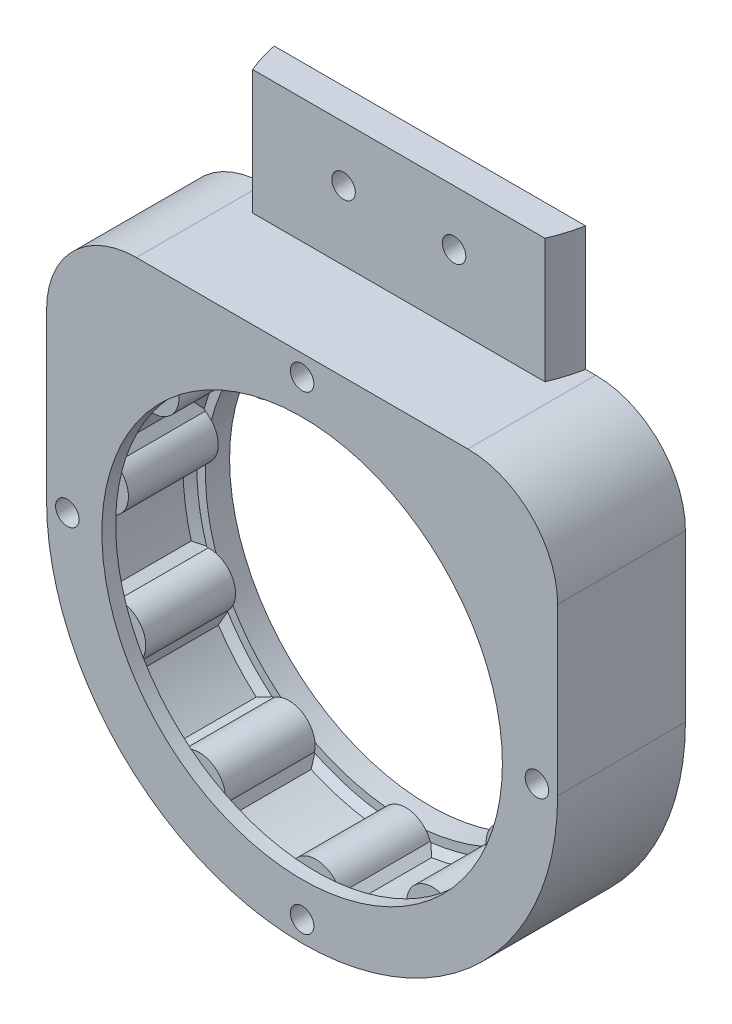
from build123d import *

# Parameters (mm, degrees)
SKETCH_1_R          = 1.7
EXTRUDE_1_DEPTH     = 13
SKETCH_2_R          = 29
EXTRUDE_2_DEPTH     = 2
EXTRUDE_START       = 3.5
SKETCH_3_R          = 29
EXTRUDE_3_DEPTH     = 3.5
CHAMFER_1_SIZE      = 1
EXTRUDE_4_DEPTH     = 18
SKETCH_5_R          = 1.7
CUT_EXTRUDE_1_DEPTH = 18
CUT_EXTRUDE_START   = -18.5
SKETCH_6_R          = 1.7
CUT_EXTRUDE_2_DEPTH = 18.5


with BuildPart() as part:
    # 草图1 → 凸台-拉伸1 (new body)
    with BuildSketch(Plane.XY):
        with BuildLine():
            Line((-37, 0), (-37, 24))
            ThreePointArc((-37, 24), (-33.192388155, 33.192388155), (-24, 37))
            Line((-24, 37), (24, 37))
            ThreePointArc((24, 37), (33.192388155, 33.192388155), (37, 24))
            Line((37, 24), (37, 0))
            ThreePointArc((37, 0), (0, -37), (-37, 0))
        make_face()
        with Locations(Location((0, -34, 0), (0, 0, 180))):
            Circle(SKETCH_1_R, mode=Mode.SUBTRACT)
        with Locations(Location((-34, 0, 0), (0, 0, 180))):
            Circle(SKETCH_1_R, mode=Mode.SUBTRACT)
        with Locations(Location((0, 34, 0), (0, 0, 180))):
            Circle(SKETCH_1_R, mode=Mode.SUBTRACT)
        with Locations(Location((34, 0, 0), (0, 0, 180))):
            Circle(SKETCH_1_R, mode=Mode.SUBTRACT)
        with BuildLine():
            ThreePointArc((-31.233783039, 0.679693363), (-30.923187588, -4.446083156), (-29.777103616, -9.451734562))
            ThreePointArc((-29.777103616, -9.451734562), (-24.98031659, -11.408128335), (-26.643000301, -16.314463551))
            ThreePointArc((-26.643000301, -16.314463551), (-23.610506772, -20.458620578), (-19.940100115, -24.050022732))
            ThreePointArc((-19.940100115, -24.050022732), (-14.847079754, -23.102507047), (-13.593253218, -28.128893561))
            ThreePointArc((-13.593253218, -28.128893561), (-8.801656881, -29.97569052), (-3.772255717, -31.012598614))
            ThreePointArc((-3.772255717, -31.012598614), (0, -27.462003005), (3.772255717, -31.012598614))
            ThreePointArc((3.772255717, -31.012598614), (8.801656881, -29.97569052), (13.593253218, -28.128893561))
            ThreePointArc((13.593253218, -28.128893561), (14.847079754, -23.102507047), (19.940100115, -24.050022732))
            ThreePointArc((19.940100115, -24.050022732), (23.610506772, -20.458620578), (26.643000301, -16.314463551))
            ThreePointArc((26.643000301, -16.314463551), (24.98031659, -11.408128335), (29.777103616, -9.451734562))
            ThreePointArc((29.777103616, -9.451734562), (30.923187588, -4.446083156), (31.233783039, 0.679693363))
            ThreePointArc((31.233783039, 0.679693363), (27.182479412, 3.908250516), (30.160087115, 8.147412549))
            ThreePointArc((30.160087115, 8.147412549), (28.417974836, 12.978054253), (25.90806035, 17.458052438))
            ThreePointArc((25.90806035, 17.458052438), (20.754397082, 17.983787444), (20.967456055, 23.159813742))
            ThreePointArc((20.967456055, 23.159813742), (16.890255867, 26.281751136), (12.356711557, 28.693603216))
            ThreePointArc((12.356711557, 28.693603216), (7.736940323, 26.349598925), (5.117805847, 30.819137712))
            ThreePointArc((5.117805847, 30.819137712), (0, 31.241177731), (-5.117805847, 30.819137712))
            ThreePointArc((-5.117805847, 30.819137712), (-7.736940323, 26.349598925), (-12.356711557, 28.693603216))
            ThreePointArc((-12.356711557, 28.693603216), (-16.890255867, 26.281751136), (-20.967456055, 23.159813742))
            ThreePointArc((-20.967456055, 23.159813742), (-20.754397082, 17.983787444), (-25.90806035, 17.458052438))
            ThreePointArc((-25.90806035, 17.458052438), (-28.417974836, 12.978054253), (-30.160087115, 8.147412549))
            ThreePointArc((-30.160087115, 8.147412549), (-27.182479412, 3.908250516), (-31.233783039, 0.679693363))
        make_face(mode=Mode.SUBTRACT)
    extrude(amount=EXTRUDE_1_DEPTH)

    # 草图2 → 凸台-拉伸2 (add)
    with BuildSketch(Plane.XY.offset(13)):
        with BuildLine():
            Line((-37, 0), (-37, 24))
            ThreePointArc((-37, 24), (-33.192388155, 33.192388155), (-24, 37))
            Line((-24, 37), (24, 37))
            ThreePointArc((24, 37), (33.192388155, 33.192388155), (37, 24))
            Line((37, 24), (37, 0))
            ThreePointArc((37, 0), (0, -37), (-37, 0))
        make_face()
        with Locations(Location((0, 0, 0), (0, 0, 177.612919058))):
            Circle(SKETCH_2_R, mode=Mode.SUBTRACT)
    extrude(amount=EXTRUDE_2_DEPTH)

    # 草图3 → 凸台-拉伸3 (add)
    with BuildSketch(Plane(origin=(0, 0, 0), x_dir=(-1, 0, 0), z_dir=(0, 0, -1)).offset(EXTRUDE_START)):
        with BuildLine():
            Line((-37, 0), (-37, 24))
            ThreePointArc((-37, 24), (-33.192388155, 33.192388155), (-24, 37))
            Line((-24, 37), (24, 37))
            ThreePointArc((24, 37), (33.192388155, 33.192388155), (37, 24))
            Line((37, 24), (37, 0))
            ThreePointArc((37, 0), (0, -37), (-37, 0))
        make_face()
        with Locations(Location((0, 0, 0), (0, 0, 2.387080942))):
            Circle(SKETCH_3_R, mode=Mode.SUBTRACT)
    extrude(amount=-EXTRUDE_3_DEPTH)

    # 倒角1
    # the kernel refuses this chamfer: 1, 0.944596536 mm, written as the material it adds along each edge
    with BuildSketch(Plane(origin=(0, 0, 0), x_dir=(-0.31866658994090813, 0.9478668706392439, 0), z_dir=(0.9478668706392439, 0.31866658994090813, 0))) as chamfer_1_piece_1:
        Polygon((31.241177731, CHAMFER_1_SIZE), (31.241177731 - CHAMFER_1_SIZE, 0), (31.241177731, 0), align=None)
    revolve(axis=Axis((0, 0, 0), (0, 0, 1)), revolution_arc=28.28993535)
    with BuildSketch(Plane(origin=(-12.356711557, 28.693603216, -2.820532611), x_dir=(-0.9121077850632814, -0.4099504706997601, 0), z_dir=(0, 0, 1))) as chamfer_1_piece_2_section:
        with BuildLine():
            Line((0.984606671, 0), (-0.076111739, 1.094687855))
            ThreePointArc((-0.076111739, 1.094687855), (0.000780153, 0.565592653), (0, 0))
            ThreePointArc((0, 0), (0.506216191, -0.003876039), (0.984606671, 0))
        make_face()
    chamfer_1_piece_2 = extrude(amount=18.641065222, mode=Mode.PRIVATE)
    chamfer_1_piece_2 = split(chamfer_1_piece_2, bisect_by=Plane(origin=(-12.356711557, 28.693603216, 15), z_dir=(0, 0, -1)), keep=Keep.TOP, mode=Mode.PRIVATE)
    add(chamfer_1_piece_2)
    with BuildSketch(Plane(origin=(-20.967456055, 23.159813742, -3.103978486), x_dir=(0.5936937329851186, -0.8046910906765371, 0), z_dir=(0, 0, 1))) as chamfer_1_piece_3_section:
        with BuildLine():
            Line((1.208926853, 0), (-0.079335217, 0.928995572))
            ThreePointArc((-0.079335217, 0.928995572), (-0.044239575, 0.477185886), (0, 0))
            ThreePointArc((0, 0), (0.620948577, 0.048617953), (1.208926853, 0))
        make_face()
    chamfer_1_piece_3 = extrude(amount=19.207956973, mode=Mode.PRIVATE)
    chamfer_1_piece_3 = split(chamfer_1_piece_3, bisect_by=Plane(origin=(-20.967456055, 23.159813742, 15), z_dir=(0, 0, -1)), keep=Keep.TOP, mode=Mode.PRIVATE)
    add(chamfer_1_piece_3)
    with BuildSketch(Plane(origin=(0, 0, 0), x_dir=(-0.7805349143645341, 0.6251121878974599, 0), z_dir=(0.6251121878974599, 0.7805349143645341, 0))) as chamfer_1_piece_4:
        Polygon((31.241177731, CHAMFER_1_SIZE), (31.241177731 - CHAMFER_1_SIZE, 0), (31.241177731, 0), align=None)
    revolve(axis=Axis((0, 0, 0), (0, 0, 1)), revolution_arc=28.28993535)
    with BuildSketch(Plane(origin=(-25.90806035, 17.458052438, -2.820532611), x_dir=(0.8738254486368232, -0.48623974057521735, 0), z_dir=(0, 0, 1))) as chamfer_1_piece_5_section:
        with BuildLine():
            Line((1.097330623, 0), (-0.068293114, -0.982235383))
            ThreePointArc((-0.068293114, -0.982235383), (-0.038978268, -0.504728194), (0, 0))
            ThreePointArc((0, 0), (0.56417639, -0.040008237), (1.097330623, 0))
        make_face()
    chamfer_1_piece_5 = extrude(amount=18.641065222, mode=Mode.PRIVATE)
    chamfer_1_piece_5 = split(chamfer_1_piece_5, bisect_by=Plane(origin=(-25.90806035, 17.458052438, 15), z_dir=(0, 0, -1)), keep=Keep.TOP, mode=Mode.PRIVATE)
    add(chamfer_1_piece_5)
    with BuildSketch(Plane(origin=(-30.160087115, 8.147412549, -3.103978486), x_dir=(0.9344957993560614, -0.3559741577500759, 0), z_dir=(0, 0, 1))) as chamfer_1_piece_6_section:
        with BuildLine():
            Line((1.208926853, 0), (-0.079335217, 0.928995572))
            ThreePointArc((-0.079335217, 0.928995572), (-0.044239575, 0.477185886), (0, 0))
            ThreePointArc((0, 0), (0.620948577, 0.048617953), (1.208926853, 0))
        make_face()
    chamfer_1_piece_6 = extrude(amount=19.207956973, mode=Mode.PRIVATE)
    chamfer_1_piece_6 = split(chamfer_1_piece_6, bisect_by=Plane(origin=(-30.160087115, 8.147412549, 15), z_dir=(0, 0, -1)), keep=Keep.TOP, mode=Mode.PRIVATE)
    add(chamfer_1_piece_6)
    with BuildSketch(Plane(origin=(0, 0, 0), x_dir=(-0.9945889184735878, 0.10388880232988909, 0), z_dir=(0.10388880232988909, 0.9945889184735878, 0))) as chamfer_1_piece_7:
        Polygon((31.241177731, CHAMFER_1_SIZE), (31.241177731 - CHAMFER_1_SIZE, 0), (31.241177731, 0), align=None)
    revolve(axis=Axis((0, 0, 0), (0, 0, 1)), revolution_arc=28.28993535)
    with BuildSketch(Plane(origin=(-31.233783039, 0.679693363, -2.820532611), x_dir=(0.9979897965675029, 0.06337480530269161, 0), z_dir=(0, 0, 1))) as chamfer_1_piece_8_section:
        with BuildLine():
            Line((1.097330623, 0), (-0.068293114, -0.982235383))
            ThreePointArc((-0.068293114, -0.982235383), (-0.038978268, -0.504728194), (0, 0))
            ThreePointArc((0, 0), (0.56417639, -0.040008237), (1.097330623, 0))
        make_face()
    chamfer_1_piece_8 = extrude(amount=18.641065222, mode=Mode.PRIVATE)
    chamfer_1_piece_8 = split(chamfer_1_piece_8, bisect_by=Plane(origin=(-31.233783039, 0.679693363, 15), z_dir=(0, 0, -1)), keep=Keep.TOP, mode=Mode.PRIVATE)
    add(chamfer_1_piece_8)
    with BuildSketch(Plane(origin=(-29.777103616, -9.451734562, -3.103978486), x_dir=(0.9786020522632545, 0.20576205506882564, 0), z_dir=(0, 0, 1))) as chamfer_1_piece_9_section:
        with BuildLine():
            Line((1.208926853, 0), (-0.079335217, 0.928995572))
            ThreePointArc((-0.079335217, 0.928995572), (-0.044239575, 0.477185886), (0, 0))
            ThreePointArc((0, 0), (0.620948577, 0.048617953), (1.208926853, 0))
        make_face()
    chamfer_1_piece_9 = extrude(amount=19.207956973, mode=Mode.PRIVATE)
    chamfer_1_piece_9 = split(chamfer_1_piece_9, bisect_by=Plane(origin=(-29.777103616, -9.451734562, 15), z_dir=(0, 0, -1)), keep=Keep.TOP, mode=Mode.PRIVATE)
    add(chamfer_1_piece_9)
    with BuildSketch(Plane(origin=(0, 0, 0), x_dir=(-0.892867968396763, -0.4503185439342214, 0), z_dir=(-0.4503185439342214, 0.892867968396763, 0))) as chamfer_1_piece_10:
        Polygon((31.241177731, CHAMFER_1_SIZE), (31.241177731 - CHAMFER_1_SIZE, 0), (31.241177731, 0), align=None)
    revolve(axis=Axis((0, 0, 0), (0, 0, 1)), revolution_arc=28.28993535)
    with BuildSketch(Plane(origin=(-26.643000301, -16.314463551, -2.820532611), x_dir=(0.5355842379268934, -0.8444818080244648, 0), z_dir=(0, 0, 1))) as chamfer_1_piece_11_section:
        with BuildLine():
            Line((0.984606671, 0), (-0.076111739, 1.094687855))
            ThreePointArc((-0.076111739, 1.094687855), (0.000780153, 0.565592653), (0, 0))
            ThreePointArc((0, 0), (0.506216191, -0.003876039), (0.984606671, 0))
        make_face()
    chamfer_1_piece_11 = extrude(amount=18.641065222, mode=Mode.PRIVATE)
    chamfer_1_piece_11 = split(chamfer_1_piece_11, bisect_by=Plane(origin=(-26.643000301, -16.314463551, 15), z_dir=(0, 0, -1)), keep=Keep.TOP, mode=Mode.PRIVATE)
    add(chamfer_1_piece_11)
    with BuildSketch(Plane(origin=(-19.940100115, -24.050022732, -3.103978486), x_dir=(0.7120090680485543, 0.7021702692485841, 0), z_dir=(0, 0, 1))) as chamfer_1_piece_12_section:
        with BuildLine():
            Line((1.208926853, 0), (-0.079335217, 0.928995572))
            ThreePointArc((-0.079335217, 0.928995572), (-0.044239575, 0.477185886), (0, 0))
            ThreePointArc((0, 0), (0.620948577, 0.048617953), (1.208926853, 0))
        make_face()
    chamfer_1_piece_12 = extrude(amount=19.207956973, mode=Mode.PRIVATE)
    chamfer_1_piece_12 = split(chamfer_1_piece_12, bisect_by=Plane(origin=(-19.940100115, -24.050022732, 15), z_dir=(0, 0, -1)), keep=Keep.TOP, mode=Mode.PRIVATE)
    add(chamfer_1_piece_12)
    with BuildSketch(Plane(origin=(0, 0, 0), x_dir=(-0.5076677470575643, -0.8615529342980017, 0), z_dir=(-0.8615529342980017, 0.5076677470575643, 0))) as chamfer_1_piece_13:
        Polygon((31.241177731, CHAMFER_1_SIZE), (31.241177731 - CHAMFER_1_SIZE, 0), (31.241177731, 0), align=None)
    revolve(axis=Axis((0, 0, 0), (0, 0, 1)), revolution_arc=28.28993535)
    with BuildSketch(Plane(origin=(-13.593253218, -28.128893561, -2.820532611), x_dir=(0.9071234673014191, -0.42086460420312277, 0), z_dir=(0, 0, 1))) as chamfer_1_piece_14_section:
        with BuildLine():
            Line((0.984606671, 0), (-0.076111739, 1.094687855))
            ThreePointArc((-0.076111739, 1.094687855), (0.000780153, 0.565592653), (0, 0))
            ThreePointArc((0, 0), (0.506216191, -0.003876039), (0.984606671, 0))
        make_face()
    chamfer_1_piece_14 = extrude(amount=18.641065222, mode=Mode.PRIVATE)
    chamfer_1_piece_14 = split(chamfer_1_piece_14, bisect_by=Plane(origin=(-13.593253218, -28.128893561, 15), z_dir=(0, 0, -1)), keep=Keep.TOP, mode=Mode.PRIVATE)
    add(chamfer_1_piece_14)
    with BuildSketch(Plane(origin=(-3.772255717, -31.012598614, -3.103978486), x_dir=(0.21935823554411138, 0.9756443842399618, 0), z_dir=(0, 0, 1))) as chamfer_1_piece_15_section:
        with BuildLine():
            Line((1.208926853, 0), (-0.079335217, 0.928995572))
            ThreePointArc((-0.079335217, 0.928995572), (-0.044239575, 0.477185886), (0, 0))
            ThreePointArc((0, 0), (0.620948577, 0.048617953), (1.208926853, 0))
        make_face()
    chamfer_1_piece_15 = extrude(amount=19.207956973, mode=Mode.PRIVATE)
    chamfer_1_piece_15 = split(chamfer_1_piece_15, bisect_by=Plane(origin=(-3.772255717, -31.012598614, 15), z_dir=(0, 0, -1)), keep=Keep.TOP, mode=Mode.PRIVATE)
    add(chamfer_1_piece_15)
    with BuildSketch(Plane(origin=(0, 0, 0), x_dir=(0.03871339696351753, -0.9992503554643075, 0), z_dir=(-0.9992503554643075, -0.03871339696351753, 0))) as chamfer_1_piece_16:
        Polygon((31.241177731, CHAMFER_1_SIZE), (31.241177731 - CHAMFER_1_SIZE, 0), (31.241177731, 0), align=None)
    revolve(axis=Axis((0, 0, 0), (0, 0, 1)), revolution_arc=28.28993535)
    with BuildSketch(Plane(origin=(3.772255717, -31.012598614, -2.820532611), x_dir=(0.9906574052358913, 0.13637413776552687, 0), z_dir=(0, 0, 1))) as chamfer_1_piece_17_section:
        with BuildLine():
            Line((0.984606671, 0), (-0.076111739, 1.094687855))
            ThreePointArc((-0.076111739, 1.094687855), (0.000780153, 0.565592653), (0, 0))
            ThreePointArc((0, 0), (0.506216191, -0.003876039), (0.984606671, 0))
        make_face()
    chamfer_1_piece_17 = extrude(amount=18.641065222, mode=Mode.PRIVATE)
    chamfer_1_piece_17 = split(chamfer_1_piece_17, bisect_by=Plane(origin=(3.772255717, -31.012598614, 15), z_dir=(0, 0, -1)), keep=Keep.TOP, mode=Mode.PRIVATE)
    add(chamfer_1_piece_17)
    with BuildSketch(Plane(origin=(13.593253218, -28.128893561, -3.103978486), x_dir=(-0.3429372868343612, 0.939358300808955, 0), z_dir=(0, 0, 1))) as chamfer_1_piece_18_section:
        with BuildLine():
            Line((1.208926853, 0), (-0.079335217, 0.928995572))
            ThreePointArc((-0.079335217, 0.928995572), (-0.044239575, 0.477185886), (0, 0))
            ThreePointArc((0, 0), (0.620948577, 0.048617953), (1.208926853, 0))
        make_face()
    chamfer_1_piece_18 = extrude(amount=19.207956973, mode=Mode.PRIVATE)
    chamfer_1_piece_18 = split(chamfer_1_piece_18, bisect_by=Plane(origin=(13.593253218, -28.128893561, 15), z_dir=(0, 0, -1)), keep=Keep.TOP, mode=Mode.PRIVATE)
    add(chamfer_1_piece_18)
    with BuildSketch(Plane(origin=(0, 0, 0), x_dir=(0.5728033109844738, -0.819692849136324, 0), z_dir=(-0.819692849136324, -0.5728033109844738, 0))) as chamfer_1_piece_19:
        Polygon((31.241177731, CHAMFER_1_SIZE), (31.241177731 - CHAMFER_1_SIZE, 0), (31.241177731, 0), align=None)
    revolve(axis=Axis((0, 0, 0), (0, 0, 1)), revolution_arc=28.28993535)
    with BuildSketch(Plane(origin=(19.940100115, -24.050022732, -2.820532611), x_dir=(0.7596646166587125, 0.6503150545672238, 0), z_dir=(0, 0, 1))) as chamfer_1_piece_20_section:
        with BuildLine():
            Line((0.984606671, 0), (-0.076111739, 1.094687855))
            ThreePointArc((-0.076111739, 1.094687855), (0.000780153, 0.565592653), (0, 0))
            ThreePointArc((0, 0), (0.506216191, -0.003876039), (0.984606671, 0))
        make_face()
    chamfer_1_piece_20 = extrude(amount=18.641065222, mode=Mode.PRIVATE)
    chamfer_1_piece_20 = split(chamfer_1_piece_20, bisect_by=Plane(origin=(19.940100115, -24.050022732, 15), z_dir=(0, 0, -1)), keep=Keep.TOP, mode=Mode.PRIVATE)
    add(chamfer_1_piece_20)
    with BuildSketch(Plane(origin=(26.643000301, -16.314463551, -3.103978486), x_dir=(-0.7963526437220034, 0.6048325940596917, 0), z_dir=(0, 0, 1))) as chamfer_1_piece_21_section:
        with BuildLine():
            Line((1.208926853, 0), (-0.079335217, 0.928995572))
            ThreePointArc((-0.079335217, 0.928995572), (-0.044239575, 0.477185886), (0, 0))
            ThreePointArc((0, 0), (0.620948577, 0.048617953), (1.208926853, 0))
        make_face()
    chamfer_1_piece_21 = extrude(amount=19.207956973, mode=Mode.PRIVATE)
    chamfer_1_piece_21 = split(chamfer_1_piece_21, bisect_by=Plane(origin=(26.643000301, -16.314463551, 15), z_dir=(0, 0, -1)), keep=Keep.TOP, mode=Mode.PRIVATE)
    add(chamfer_1_piece_21)
    with BuildSketch(Plane(origin=(0, 0, 0), x_dir=(0.9250322210026573, -0.3798886548804678, 0), z_dir=(-0.3798886548804678, -0.9250322210026573, 0))) as chamfer_1_piece_22:
        Polygon((31.241177731, CHAMFER_1_SIZE), (31.241177731 - CHAMFER_1_SIZE, 0), (31.241177731, 0), align=None)
    revolve(axis=Axis((0, 0, 0), (0, 0, 1)), revolution_arc=28.28993535)
    with BuildSketch(Plane(origin=(29.777103616, -9.451734562, -2.820532611), x_dir=(0.28748367982607836, 0.9577855364504398, 0), z_dir=(0, 0, 1))) as chamfer_1_piece_23_section:
        with BuildLine():
            Line((0.984606671, 0), (-0.076111739, 1.094687855))
            ThreePointArc((-0.076111739, 1.094687855), (0.000780153, 0.565592653), (0, 0))
            ThreePointArc((0, 0), (0.506216191, -0.003876039), (0.984606671, 0))
        make_face()
    chamfer_1_piece_23 = extrude(amount=18.641065222, mode=Mode.PRIVATE)
    chamfer_1_piece_23 = split(chamfer_1_piece_23, bisect_by=Plane(origin=(29.777103616, -9.451734562, 15), z_dir=(0, 0, -1)), keep=Keep.TOP, mode=Mode.PRIVATE)
    add(chamfer_1_piece_23)
    with BuildSketch(Plane(origin=(31.233783039, 0.679693363, -3.103978486), x_dir=(-0.996931662986807, 0.07827681223938102, 0), z_dir=(0, 0, 1))) as chamfer_1_piece_24_section:
        with BuildLine():
            Line((1.208926853, 0), (-0.079335217, 0.928995572))
            ThreePointArc((-0.079335217, 0.928995572), (-0.044239575, 0.477185886), (0, 0))
            ThreePointArc((0, 0), (0.620948577, 0.048617953), (1.208926853, 0))
        make_face()
    chamfer_1_piece_24 = extrude(amount=19.207956973, mode=Mode.PRIVATE)
    chamfer_1_piece_24 = split(chamfer_1_piece_24, bisect_by=Plane(origin=(31.233783039, 0.679693363, 15), z_dir=(0, 0, -1)), keep=Keep.TOP, mode=Mode.PRIVATE)
    add(chamfer_1_piece_24)
    with BuildSketch(Plane(origin=(0, 0, 0), x_dir=(0.983569936817843, 0.18052750313496313, 0), z_dir=(0.18052750313496313, -0.983569936817843, 0))) as chamfer_1_piece_25:
        Polygon((31.241177731, CHAMFER_1_SIZE), (31.241177731 - CHAMFER_1_SIZE, 0), (31.241177731, 0), align=None)
    revolve(axis=Axis((0, 0, 0), (0, 0, 1)), revolution_arc=28.28993535)
    with BuildSketch(Plane(origin=(30.160087115, 8.147412549, -2.820532611), x_dir=(-0.27597129408871796, 0.9611658778998546, 0), z_dir=(0, 0, 1))) as chamfer_1_piece_26_section:
        with BuildLine():
            Line((0.984606671, 0), (-0.076111739, 1.094687855))
            ThreePointArc((-0.076111739, 1.094687855), (0.000780153, 0.565592653), (0, 0))
            ThreePointArc((0, 0), (0.506216191, -0.003876039), (0.984606671, 0))
        make_face()
    chamfer_1_piece_26 = extrude(amount=18.641065222, mode=Mode.PRIVATE)
    chamfer_1_piece_26 = split(chamfer_1_piece_26, bisect_by=Plane(origin=(30.160087115, 8.147412549, 15), z_dir=(0, 0, -1)), keep=Keep.TOP, mode=Mode.PRIVATE)
    add(chamfer_1_piece_26)
    with BuildSketch(Plane(origin=(25.90806035, 17.458052438, -3.103978486), x_dir=(-0.8809919232358322, -0.4731313043894153, 0), z_dir=(0, 0, 1))) as chamfer_1_piece_27_section:
        with BuildLine():
            Line((1.208926853, 0), (-0.079335217, 0.928995572))
            ThreePointArc((-0.079335217, 0.928995572), (-0.044239575, 0.477185886), (0, 0))
            ThreePointArc((0, 0), (0.620948577, 0.048617953), (1.208926853, 0))
        make_face()
    chamfer_1_piece_27 = extrude(amount=19.207956973, mode=Mode.PRIVATE)
    chamfer_1_piece_27 = split(chamfer_1_piece_27, bisect_by=Plane(origin=(25.90806035, 17.458052438, 15), z_dir=(0, 0, -1)), keep=Keep.TOP, mode=Mode.PRIVATE)
    add(chamfer_1_piece_27)
    with BuildSketch(Plane(origin=(0, 0, 0), x_dir=(0.7298311472664472, 0.6836274544514296, 0), z_dir=(0.6836274544514296, -0.7298311472664472, 0))) as chamfer_1_piece_28:
        Polygon((31.241177731, CHAMFER_1_SIZE), (31.241177731 - CHAMFER_1_SIZE, 0), (31.241177731, 0), align=None)
    revolve(axis=Axis((0, 0, 0), (0, 0, 1)), revolution_arc=28.28993535)
    with BuildSketch(Plane(origin=(20.967456055, 23.159813742, -2.820532611), x_dir=(-0.7518073320503345, 0.6593828443896294, 0), z_dir=(0, 0, 1))) as chamfer_1_piece_29_section:
        with BuildLine():
            Line((0.984606671, 0), (-0.076111739, 1.094687855))
            ThreePointArc((-0.076111739, 1.094687855), (0.000780153, 0.565592653), (0, 0))
            ThreePointArc((0, 0), (0.506216191, -0.003876039), (0.984606671, 0))
        make_face()
    chamfer_1_piece_29 = extrude(amount=18.641065222, mode=Mode.PRIVATE)
    chamfer_1_piece_29 = split(chamfer_1_piece_29, bisect_by=Plane(origin=(20.967456055, 23.159813742, 15), z_dir=(0, 0, -1)), keep=Keep.TOP, mode=Mode.PRIVATE)
    add(chamfer_1_piece_29)
    with BuildSketch(Plane(origin=(12.356711557, 28.693603216, -3.103978486), x_dir=(-0.48534347264895716, -0.8743235748606182, 0), z_dir=(0, 0, 1))) as chamfer_1_piece_30_section:
        with BuildLine():
            Line((1.208926853, 0), (-0.079335217, 0.928995572))
            ThreePointArc((-0.079335217, 0.928995572), (-0.044239575, 0.477185886), (0, 0))
            ThreePointArc((0, 0), (0.620948577, 0.048617953), (1.208926853, 0))
        make_face()
    chamfer_1_piece_30 = extrude(amount=19.207956973, mode=Mode.PRIVATE)
    chamfer_1_piece_30 = split(chamfer_1_piece_30, bisect_by=Plane(origin=(12.356711557, 28.693603216, 15), z_dir=(0, 0, -1)), keep=Keep.TOP, mode=Mode.PRIVATE)
    add(chamfer_1_piece_30)
    with BuildSketch(Plane(origin=(0, 0, 0), x_dir=(0.24437612519842147, 0.9696805192603415, 0), z_dir=(0.9696805192603415, -0.24437612519842147, 0))) as chamfer_1_piece_31:
        Polygon((31.241177731, CHAMFER_1_SIZE), (31.241177731 - CHAMFER_1_SIZE, 0), (31.241177731, 0), align=None)
    revolve(axis=Axis((0, 0, 0), (0, 0, 1)), revolution_arc=28.28993535)
    with BuildSketch(Plane(origin=(5.117805847, 30.819137712, -2.820532611), x_dir=(-0.9889498541027343, 0.14825041676224868, 0), z_dir=(0, 0, 1))) as chamfer_1_piece_32_section:
        with BuildLine():
            Line((0.984606671, 0), (-0.076111739, 1.094687855))
            ThreePointArc((-0.076111739, 1.094687855), (0.000780153, 0.565592653), (0, 0))
            ThreePointArc((0, 0), (0.506216191, -0.003876039), (0.984606671, 0))
        make_face()
    chamfer_1_piece_32 = extrude(amount=18.641065222, mode=Mode.PRIVATE)
    chamfer_1_piece_32 = split(chamfer_1_piece_32, bisect_by=Plane(origin=(5.117805847, 30.819137712, 15), z_dir=(0, 0, -1)), keep=Keep.TOP, mode=Mode.PRIVATE)
    add(chamfer_1_piece_32)
    with BuildSketch(Plane(origin=(-5.117805847, 30.819137712, -3.103978486), x_dir=(0.06439810123085943, -0.9979242879887532, 0), z_dir=(0, 0, 1))) as chamfer_1_piece_33_section:
        with BuildLine():
            Line((1.208926853, 0), (-0.079335217, 0.928995572))
            ThreePointArc((-0.079335217, 0.928995572), (-0.044239575, 0.477185886), (0, 0))
            ThreePointArc((0, 0), (0.620948577, 0.048617953), (1.208926853, 0))
        make_face()
    chamfer_1_piece_33 = extrude(amount=19.207956973, mode=Mode.PRIVATE)
    chamfer_1_piece_33 = split(chamfer_1_piece_33, bisect_by=Plane(origin=(-5.117805847, 30.819137712, 15), z_dir=(0, 0, -1)), keep=Keep.TOP, mode=Mode.PRIVATE)
    add(chamfer_1_piece_33)
    with BuildSketch(Plane(origin=(0, 0, 13), x_dir=(-0.31866658994090813, 0.9478668706392439, 0), z_dir=(0.9478668706392439, 0.31866658994090813, 0))) as chamfer_1_piece_34:
        Polygon((31.241177731, -CHAMFER_1_SIZE), (31.241177731 - CHAMFER_1_SIZE, 0), (31.241177731, 0), align=None)
    revolve(axis=Axis((0, 0, 13), (0, 0, 1)), revolution_arc=28.28993535)
    with BuildSketch(Plane(origin=(0, 0, 13), x_dir=(-0.7805349143645341, 0.6251121878974599, 0), z_dir=(0.6251121878974599, 0.7805349143645341, 0))) as chamfer_1_piece_35:
        Polygon((31.241177731 - CHAMFER_1_SIZE, 0), (31.241177731, -CHAMFER_1_SIZE), (31.241177731, 0), align=None)
    revolve(axis=Axis((0, 0, 13), (0, 0, 1)), revolution_arc=28.28993535)
    with BuildSketch(Plane(origin=(0, 0, 13), x_dir=(-0.9945889184735878, 0.10388880232988909, 0), z_dir=(0.10388880232988909, 0.9945889184735878, 0))) as chamfer_1_piece_36:
        Polygon((31.241177731 - CHAMFER_1_SIZE, 0), (31.241177731, -CHAMFER_1_SIZE), (31.241177731, 0), align=None)
    revolve(axis=Axis((0, 0, 13), (0, 0, 1)), revolution_arc=28.28993535)
    with BuildSketch(Plane(origin=(0, 0, 13), x_dir=(-0.892867968396763, -0.4503185439342214, 0), z_dir=(-0.4503185439342214, 0.892867968396763, 0))) as chamfer_1_piece_37:
        Polygon((31.241177731, -CHAMFER_1_SIZE), (31.241177731 - CHAMFER_1_SIZE, 0), (31.241177731, 0), align=None)
    revolve(axis=Axis((0, 0, 13), (0, 0, 1)), revolution_arc=28.28993535)
    with BuildSketch(Plane(origin=(0, 0, 13), x_dir=(-0.5076677470575643, -0.8615529342980017, 0), z_dir=(-0.8615529342980017, 0.5076677470575643, 0))) as chamfer_1_piece_38:
        Polygon((31.241177731, -CHAMFER_1_SIZE), (31.241177731 - CHAMFER_1_SIZE, 0), (31.241177731, 0), align=None)
    revolve(axis=Axis((0, 0, 13), (0, 0, 1)), revolution_arc=28.28993535)
    with BuildSketch(Plane(origin=(0, 0, 13), x_dir=(0.03871339696351753, -0.9992503554643075, 0), z_dir=(-0.9992503554643075, -0.03871339696351753, 0))) as chamfer_1_piece_39:
        Polygon((31.241177731, -CHAMFER_1_SIZE), (31.241177731 - CHAMFER_1_SIZE, 0), (31.241177731, 0), align=None)
    revolve(axis=Axis((0, 0, 13), (0, 0, 1)), revolution_arc=28.28993535)
    with BuildSketch(Plane(origin=(0, 0, 13), x_dir=(0.5728033109844738, -0.819692849136324, 0), z_dir=(-0.819692849136324, -0.5728033109844738, 0))) as chamfer_1_piece_40:
        Polygon((31.241177731, -CHAMFER_1_SIZE), (31.241177731 - CHAMFER_1_SIZE, 0), (31.241177731, 0), align=None)
    revolve(axis=Axis((0, 0, 13), (0, 0, 1)), revolution_arc=28.28993535)
    with BuildSketch(Plane(origin=(0, 0, 13), x_dir=(0.9250322210026573, -0.3798886548804678, 0), z_dir=(-0.3798886548804678, -0.9250322210026573, 0))) as chamfer_1_piece_41:
        Polygon((31.241177731, -CHAMFER_1_SIZE), (31.241177731 - CHAMFER_1_SIZE, 0), (31.241177731, 0), align=None)
    revolve(axis=Axis((0, 0, 13), (0, 0, 1)), revolution_arc=28.28993535)
    with BuildSketch(Plane(origin=(0, 0, 13), x_dir=(0.983569936817843, 0.18052750313496313, 0), z_dir=(0.18052750313496313, -0.983569936817843, 0))) as chamfer_1_piece_42:
        Polygon((31.241177731, -CHAMFER_1_SIZE), (31.241177731 - CHAMFER_1_SIZE, 0), (31.241177731, 0), align=None)
    revolve(axis=Axis((0, 0, 13), (0, 0, 1)), revolution_arc=28.28993535)
    with BuildSketch(Plane(origin=(0, 0, 13), x_dir=(0.7298311472664472, 0.6836274544514296, 0), z_dir=(0.6836274544514296, -0.7298311472664472, 0))) as chamfer_1_piece_43:
        Polygon((31.241177731, -CHAMFER_1_SIZE), (31.241177731 - CHAMFER_1_SIZE, 0), (31.241177731, 0), align=None)
    revolve(axis=Axis((0, 0, 13), (0, 0, 1)), revolution_arc=28.28993535)
    with BuildSketch(Plane(origin=(0, 0, 13), x_dir=(0.24437612519842142, 0.9696805192603415, 0), z_dir=(0.9696805192603415, -0.24437612519842142, 0))) as chamfer_1_piece_44:
        Polygon((31.241177731, -CHAMFER_1_SIZE), (31.241177731 - CHAMFER_1_SIZE, 0), (31.241177731, 0), align=None)
    revolve(axis=Axis((0, 0, 13), (0, 0, 1)), revolution_arc=28.28993535)

    # 草图4 → 凸台-拉伸4 (add)
    with BuildSketch(Plane(origin=(0, 37, 0), x_dir=(1, 0, 0), z_dir=(0, 1, 0))):
        with BuildLine():
            Line((0, 3.5), (-22.555487137, 3.5))
            ThreePointArc((-22.555487137, 3.5), (-21.976233496, 1.214341496), (-21.166010489, -1))
            Line((-21.166010489, -1), (0, -1))
            Line((0, -1), (0, 3.5))
        make_face()
        with BuildLine():
            Line((22.555487137, 3.5), (0, 3.5))
            Line((0, 3.5), (0, -1))
            Line((0, -1), (21.166010489, -1))
            ThreePointArc((21.166010489, -1), (21.976233496, 1.214341496), (22.555487137, 3.5))
        make_face()
    extrude(amount=EXTRUDE_4_DEPTH)

    # 草图5 → 切除-拉伸1 (cut)
    with BuildSketch(Plane(origin=(0, 0, -3.5), x_dir=(-1, 0, 0), z_dir=(0, 0, -1))):
        with Locations((-8, 47)):
            Circle(SKETCH_5_R)
        with Locations((8, 47)):
            Circle(SKETCH_5_R)
    extrude(amount=-CUT_EXTRUDE_1_DEPTH, mode=Mode.SUBTRACT)

    # 草图6 → 切除-拉伸2 (cut)
    with BuildSketch(Plane.XY.offset(15).offset(CUT_EXTRUDE_START)):
        with Locations(Location((0, 34, 0), (0, 0, 180))):
            Circle(SKETCH_6_R)
        with Locations(Location((-34, 0, 0), (0, 0, 180))):
            Circle(SKETCH_6_R)
        with Locations(Location((0, -34, 0), (0, 0, 180))):
            Circle(SKETCH_6_R)
        with Locations(Location((34, 0, 0), (0, 0, 180))):
            Circle(SKETCH_6_R)
    extrude(amount=CUT_EXTRUDE_2_DEPTH, mode=Mode.SUBTRACT)


solid = part.part
